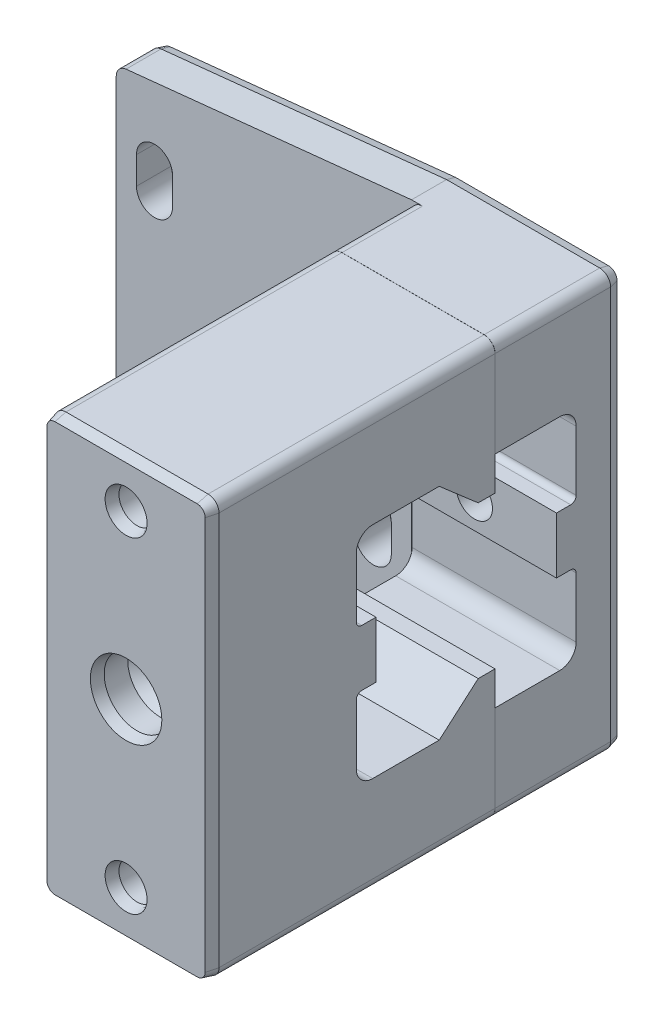
from build123d import *
from OCP.BRepFilletAPI import BRepFilletAPI_MakeChamfer

# Parameters (mm, degrees)
SKETCH1_R       = 1.65
SKETCH1_W       = 27
SKETCH1_H       = 32.4
EXTRUDE1_DEPTH  = 4
EXTRUDE2_DEPTH  = 4
FILLET1_R       = 1
SKETCH_R        = 1.65
EXTRUDE3_DEPTH  = 37.6
EXTRUDE4_REACH  = 52.193
EXTRUDE5_REACH  = 49.347
SKETCH4_R       = 1.65
FILLET2_R       = 1
EXTRUDE6_START  = -15
SKETCH5_W       = 0.01
SKETCH5_H       = 44.520085812
EXTRUDE6_DEPTH  = 15
EXTRUDE7_DEPTH  = 15
SKETCH7_W       = 15
SKETCH7_H       = 5.15
SKETCH7_R       = 1.65
EXTRUDE8_DEPTH  = 1.8
SKETCH_2_R      = 1.65
EXTRUDE9_DEPTH  = 48.347330088
SKETCH8_W       = 15
SKETCH8_H       = 5.15
SKETCH8_R       = 1.65
EXTRUDE10_DEPTH = 1.8
SKETCH11_R      = 3
EXTRUDE15_DEPTH = 3
CHAMFER1_SIZE   = 1.5
FILLET7_R       = 0.5
FILLET8_R       = 0.5
CHAMFER4_SIZE   = 1
CHAMFER4_SIZE2  = 0.267949192
EXTRUDE14_DEPTH = 10.5
CHAMFER5_SIZE   = 0.8
CHAMFER5_SIZE2  = 0.214359354
CHAMFER6_SIZE   = 0.8
CHAMFER6_SIZE2  = 0.214359354
EXTRUDE16_DEPTH = 5
CHAMFER7_SIZE   = 0.8
CHAMFER7_SIZE2  = 0.214359354


with BuildPart() as part:
    # Sketch1 → Extrude1 (new body)
    # profile 1 of 2: a face of its own
    with BuildSketch(Plane.XY):
        Polygon((6.246843528, 16.60570294), (6.246843528, -15.79429706), (6.246843528, -18.59429706), (21.246843528, -18.59429706), (21.246843528, 19.40570294), (6.246843528, 19.40570294), align=None)
        with Locations((13.746843528, -14.49429706)):
            Circle(SKETCH1_R, mode=Mode.SUBTRACT)
        with Locations((13.746843528, 15.30570294)):
            Circle(SKETCH1_R, mode=Mode.SUBTRACT)
    # profile 2 of 2: a face of its own
    with BuildSketch(Plane.XY):
        with Locations((-7.253156472, 0.40570294)):
            Rectangle(SKETCH1_W, SKETCH1_H)
        with BuildLine():
            ThreePointArc((-15.603156472, -9.59429706), (-17.253156472, -11.24429706), (-18.903156472, -9.59429706))
            Line((-18.903156472, -9.59429706), (-18.903156472, -7.09429706))
            ThreePointArc((-18.903156472, -7.09429706), (-17.253156472, -5.44429706), (-15.603156472, -7.09429706))
            Line((-15.603156472, -7.09429706), (-15.603156472, -9.59429706))
        make_face(mode=Mode.SUBTRACT)
        with BuildLine():
            ThreePointArc((4.396843528, -9.59429706), (2.746843528, -11.24429706), (1.096843528, -9.59429706))
            Line((1.096843528, -9.59429706), (1.096843528, -7.09429706))
            ThreePointArc((1.096843528, -7.09429706), (2.746843528, -5.44429706), (4.396843528, -7.09429706))
            Line((4.396843528, -7.09429706), (4.396843528, -9.59429706))
        make_face(mode=Mode.SUBTRACT)
        with BuildLine():
            ThreePointArc((-18.903156472, 10.40570294), (-17.253156472, 12.05570294), (-15.603156472, 10.40570294))
            Line((-15.603156472, 10.40570294), (-15.603156472, 7.90570294))
            ThreePointArc((-15.603156472, 7.90570294), (-17.253156472, 6.25570294), (-18.903156472, 7.90570294))
            Line((-18.903156472, 7.90570294), (-18.903156472, 10.40570294))
        make_face(mode=Mode.SUBTRACT)
        with BuildLine():
            ThreePointArc((1.096843528, 10.40570294), (2.746843528, 12.05570294), (4.396843528, 10.40570294))
            Line((4.396843528, 10.40570294), (4.396843528, 7.90570294))
            ThreePointArc((4.396843528, 7.90570294), (2.746843528, 6.25570294), (1.096843528, 7.90570294))
            Line((1.096843528, 7.90570294), (1.096843528, 10.40570294))
        make_face(mode=Mode.SUBTRACT)
    extrude(amount=EXTRUDE1_DEPTH)

    # Sketch2 → Extrude2 (add)
    with BuildSketch(Plane(origin=(0, 0, 0), x_dir=(-1, 0, 0), z_dir=(0, 0, -1))):
        Polygon((-6.246843528, 19.40570294), (20.753156472, 16.60570294), (-6.246843528, 16.60570294), align=None)
        Polygon((-6.246843528, -15.79429706), (-6.246843528, -18.59429706), (20.753156472, -15.79429706), align=None)
    extrude(amount=-EXTRUDE2_DEPTH)

    # Fillet1
    fillet1_edges = [part.edges().sort_by_distance(p)[0] for p in [
        (-20.753156472, -15.79429706, 2),
        (-20.753156472, 16.60570294, 2),
    ]]
    fillet(fillet1_edges, radius=FILLET1_R)

    # Sketch → Extrude3 (add)
    with BuildSketch(Plane.XY):
        Polygon((21.246843528, 19.40570294), (6.246843528, 19.40570294), (6.246843528, 16.60570294), (6.246843528, -15.79429706), (6.246843528, -18.59429706), (21.246843528, -18.59429706), align=None)
        with Locations((13.746843528, -14.49429706)):
            Circle(SKETCH_R, mode=Mode.SUBTRACT)
        with Locations((13.746843528, 15.30570294)):
            Circle(SKETCH_R, mode=Mode.SUBTRACT)
    extrude(amount=EXTRUDE3_DEPTH)

    # Sketch3 → Extrude4 (cut, up to next)
    with BuildSketch(Plane.ZY.offset(-6.246843528), mode=Mode.PRIVATE) as extrude4_sk1:
        with BuildLine():
            Line((22.55, -9.64429706), (5.45, -9.64429706))
            ThreePointArc((5.45, -9.64429706), (4.389339828, -9.204957232), (3.95, -8.14429706))
            Line((3.95, -8.14429706), (3.95, 8.95570294))
            ThreePointArc((3.95, 8.95570294), (4.389339828, 10.016363112), (5.45, 10.45570294))
            Line((5.45, 10.45570294), (22.55, 10.45570294))
            ThreePointArc((22.55, 10.45570294), (23.610660172, 10.016363112), (24.05, 8.95570294))
            Line((24.05, 8.95570294), (24.05, -8.14429706))
            ThreePointArc((24.05, -8.14429706), (23.610660172, -9.204957232), (22.55, -9.64429706))
        make_face()
    extrude4_tool1 = extrude(extrude4_sk1.sketch, amount=-EXTRUDE4_REACH, mode=Mode.PRIVATE) & part.part
    add(extrude4_tool1.solids().sort_by_distance((6.246844, 0.405703, 14))[0], mode=Mode.SUBTRACT)

    # Sketch4 → Extrude5 (cut, up to next)
    with BuildSketch(Plane(origin=(0, 0, 0), x_dir=(-1, 0, 0), z_dir=(0, 0, -1)), mode=Mode.PRIVATE) as extrude5_sk1:
        with Locations((-13.746843528, 0.40570294)):
            Circle(SKETCH4_R)
    extrude5_tool1 = extrude(extrude5_sk1.sketch, amount=-EXTRUDE5_REACH, mode=Mode.PRIVATE) & part.part
    add(extrude5_tool1.solids().sort_by_distance((13.746844, 0.405703, 0))[0], mode=Mode.SUBTRACT)

    # Fillet2
    fillet2_edges = [part.edges().sort_by_distance(p)[0] for p in [
        (6.246843528, 19.40570294, 20.8),
        (6.246843528, -18.59429706, 20.8),
        (21.246843528, 19.40570294, 18.8),
        (21.246843528, -18.59429706, 18.8),
    ]]
    fillet(fillet2_edges, radius=FILLET2_R)

    # Sketch5 → Extrude6 (cut)
    with BuildSketch(Plane(origin=(21.246843528, 0, 0), x_dir=(0, 0, -1), z_dir=(1, 0, 0)).offset(EXTRUDE6_START)):
        with Locations((-11.365, -0.632215512)):
            Rectangle(SKETCH5_W, SKETCH5_H)
    extrude(amount=EXTRUDE6_DEPTH, mode=Mode.SUBTRACT)


with BuildPart() as extrude6_piece_1:
    # of the separate pieces the step leaves, piece 1, a body of its own (extrude6_pieces)
    add(part.part.solids().sort_by_distance((7.246843528, -18.59429706, 11.37))[0])

    # Sketch6 → Extrude7 (add)
    with BuildSketch(Plane(origin=(21.246843528, 0, 0), x_dir=(0, 0, -1), z_dir=(1, 0, 0))):
        Polygon((-11.37, 10.45570294), (-11.37, 7.362293772), (-12.906590833, 7.362293772), (-16.47, 10.45570294), align=None)
        Polygon((-16.47, -9.64429706), (-11.37, -9.64429706), (-11.37, -6.550887893), (-12.906590833, -6.550887893), align=None)
    extrude(amount=-EXTRUDE7_DEPTH)

    # Sketch 2 → Extrude9 (cut, through all)
    with BuildSketch(Plane(origin=(0, 0, 0), x_dir=(-1, 0, 0), z_dir=(0, 0, -1))):
        with Locations((-13.746843528, 0.40570294)):
            Circle(SKETCH_2_R)
    extrude(amount=-EXTRUDE9_DEPTH, mode=Mode.SUBTRACT)

    # Sketch8 → Extrude10 (add)
    with BuildSketch(Plane(origin=(0, 0, 24.05), x_dir=(-1, 0, 0), z_dir=(0, 0, -1))):
        with Locations((-13.746843528, 0.40570294)):
            Rectangle(SKETCH8_W, SKETCH8_H)
        with Locations((-13.746843528, 0.40570294)):
            Circle(SKETCH8_R, mode=Mode.SUBTRACT)
    extrude(amount=EXTRUDE10_DEPTH)

    # Sketch11 → Extrude15 (cut)
    with BuildSketch(Plane.XY.offset(37.6)):
        with Locations((13.746843528, 0.40570294)):
            Circle(SKETCH11_R)
    extrude(amount=-EXTRUDE15_DEPTH, mode=Mode.SUBTRACT)

    # Chamfer1
    # the kernel refuses this chamfer: 1.5 mm, written as the material it takes off along each edge
    with BuildSketch(Plane(origin=(13.746843528, 0.40570294, 34.6), x_dir=(-1, 0, 0), z_dir=(0, -1, 0))) as chamfer1_piece_1_section:
        Polygon((1.65 + CHAMFER1_SIZE, 0), (1.65, CHAMFER1_SIZE), (1.65, 0), align=None)
    chamfer1_piece_1 = revolve(axis=Axis((13.746843528, 0.40570294, 34.6), (0, 0, -1)), mode=Mode.PRIVATE)
    chamfer1_piece_1 = chamfer1_piece_1 & Plane(origin=(13.746843528, 0.40570294, 33.771694066), x_dir=(1, 0, 0), z_dir=(0, 0, 1)) * Cylinder(3, 13, mode=Mode.PRIVATE)
    add(chamfer1_piece_1, mode=Mode.SUBTRACT)

    # Fillet7
    fillet7_edges = [extrude6_piece_1.edges().sort_by_distance(p)[0] for p in [
        (13.746843528, 2.98070294, 24.05),
        (13.746843528, -2.16929706, 24.05),
    ]]
    fillet(fillet7_edges, radius=FILLET7_R)

    # Chamfer4: one chamfer whose edges measure the first distance from different faces: ONE call of the kernel's chamfer builder (chamfer() names one face for all edges)
    chamfer4_edges_1 = [extrude6_piece_1.edges().sort_by_distance(p)[0] for p in [
        (12.096843528, 15.30570294, 37.6),
    ]]
    chamfer4_side_1 = [extrude6_piece_1.faces().sort_by_distance(p)[0] for p in [
        (12.096843528, 15.30570294, 24.485),
    ]]
    chamfer4_edges_2 = [extrude6_piece_1.edges().sort_by_distance(p)[0] for p in [
        (12.096843528, -14.49429706, 37.6),
    ]]
    chamfer4_side_2 = [extrude6_piece_1.faces().sort_by_distance(p)[0] for p in [
        (12.096843528, -14.49429706, 24.485),
    ]]
    chamfer4_edges_3 = [extrude6_piece_1.edges().sort_by_distance(p)[0] for p in [
        (13.746843528, -18.59429706, 37.6),
    ]]
    chamfer4_side_3 = [extrude6_piece_1.faces().sort_by_distance(p)[0] for p in [
        (13.746843528, -18.59429706, 24.485),
    ]]
    chamfer4_edges_4 = [extrude6_piece_1.edges().sort_by_distance(p)[0] for p in [
        (6.246843528, 0.40570294, 37.6),
    ]]
    chamfer4_side_4 = [extrude6_piece_1.faces().sort_by_distance(p)[0] for p in [
        (6.246843528, 0.40570294, 26.542021551),
    ]]
    chamfer4_edges_5 = [extrude6_piece_1.edges().sort_by_distance(p)[0] for p in [
        (13.746843528, 19.40570294, 37.6),
    ]]
    chamfer4_side_5 = [extrude6_piece_1.faces().sort_by_distance(p)[0] for p in [
        (13.746843528, 19.40570294, 24.485),
    ]]
    chamfer4_edges_6 = [extrude6_piece_1.edges().sort_by_distance(p)[0] for p in [
        (21.246843528, 0.40570294, 37.6),
    ]]
    chamfer4_side_6 = [extrude6_piece_1.faces().sort_by_distance(p)[0] for p in [
        (21.246843528, 0.40570294, 26.542021551),
    ]]
    chamfer4_edges_7 = [extrude6_piece_1.edges().sort_by_distance(p)[0] for p in [
        (20.953950309, 19.112809721, 37.6),
    ]]
    chamfer4_side_7 = [extrude6_piece_1.faces().sort_by_distance(p)[0] for p in [
        (20.953950309, 19.112809721, 24.485),
    ]]
    chamfer4_edges_8 = [extrude6_piece_1.edges().sort_by_distance(p)[0] for p in [
        (20.953950309, -18.301403841, 37.6),
    ]]
    chamfer4_side_8 = [extrude6_piece_1.faces().sort_by_distance(p)[0] for p in [
        (20.953950309, -18.301403841, 24.485),
    ]]
    chamfer4_edges_9 = [extrude6_piece_1.edges().sort_by_distance(p)[0] for p in [
        (6.539736747, 19.112809721, 37.6),
    ]]
    chamfer4_side_9 = [extrude6_piece_1.faces().sort_by_distance(p)[0] for p in [
        (6.539736747, 19.112809721, 24.485),
    ]]
    chamfer4_edges_10 = [extrude6_piece_1.edges().sort_by_distance(p)[0] for p in [
        (6.539736747, -18.301403841, 37.6),
    ]]
    chamfer4_side_10 = [extrude6_piece_1.faces().sort_by_distance(p)[0] for p in [
        (6.539736747, -18.301403841, 24.485),
    ]]
    chamfer4_edges_11 = [extrude6_piece_1.edges().sort_by_distance(p)[0] for p in [
        (10.746843528, 0.40570294, 37.6),
    ]]
    chamfer4_side_11 = [extrude6_piece_1.faces().sort_by_distance(p)[0] for p in [
        (10.746843528, 0.40570294, 36.025),
    ]]
    chamfer4 = BRepFilletAPI_MakeChamfer(extrude6_piece_1.part.solid().wrapped)
    for e in chamfer4_edges_1:
        chamfer4.Add(CHAMFER4_SIZE, CHAMFER4_SIZE2, e.wrapped, chamfer4_side_1[0].wrapped)  # the first distance lies on this face
    for e in chamfer4_edges_2:
        chamfer4.Add(CHAMFER4_SIZE, CHAMFER4_SIZE2, e.wrapped, chamfer4_side_2[0].wrapped)  # the first distance lies on this face
    for e in chamfer4_edges_3:
        chamfer4.Add(CHAMFER4_SIZE, CHAMFER4_SIZE2, e.wrapped, chamfer4_side_3[0].wrapped)  # the first distance lies on this face
    for e in chamfer4_edges_4:
        chamfer4.Add(CHAMFER4_SIZE, CHAMFER4_SIZE2, e.wrapped, chamfer4_side_4[0].wrapped)  # the first distance lies on this face
    for e in chamfer4_edges_5:
        chamfer4.Add(CHAMFER4_SIZE, CHAMFER4_SIZE2, e.wrapped, chamfer4_side_5[0].wrapped)  # the first distance lies on this face
    for e in chamfer4_edges_6:
        chamfer4.Add(CHAMFER4_SIZE, CHAMFER4_SIZE2, e.wrapped, chamfer4_side_6[0].wrapped)  # the first distance lies on this face
    for e in chamfer4_edges_7:
        chamfer4.Add(CHAMFER4_SIZE, CHAMFER4_SIZE2, e.wrapped, chamfer4_side_7[0].wrapped)  # the first distance lies on this face
    for e in chamfer4_edges_8:
        chamfer4.Add(CHAMFER4_SIZE, CHAMFER4_SIZE2, e.wrapped, chamfer4_side_8[0].wrapped)  # the first distance lies on this face
    for e in chamfer4_edges_9:
        chamfer4.Add(CHAMFER4_SIZE, CHAMFER4_SIZE2, e.wrapped, chamfer4_side_9[0].wrapped)  # the first distance lies on this face
    for e in chamfer4_edges_10:
        chamfer4.Add(CHAMFER4_SIZE, CHAMFER4_SIZE2, e.wrapped, chamfer4_side_10[0].wrapped)  # the first distance lies on this face
    for e in chamfer4_edges_11:
        chamfer4.Add(CHAMFER4_SIZE, CHAMFER4_SIZE2, e.wrapped, chamfer4_side_11[0].wrapped)  # the first distance lies on this face
    add(Compound.cast(chamfer4.Shape()), mode=Mode.REPLACE)

    # Sketch10 → Extrude14 (cut)
    with BuildSketch(Plane(origin=(0, 0, 11.37), x_dir=(-1, 0, 0), z_dir=(0, 0, -1))):
        Polygon((-10.917827209, 15.30570294), (-12.332335368, 17.75570294), (-15.161351687, 17.75570294), (-16.575859847, 15.30570294), (-15.161351687, 12.85570294), (-12.332335368, 12.85570294), align=None)
        Polygon((-10.917827209, -14.49429706), (-12.332335368, -12.04429706), (-15.161351687, -12.04429706), (-16.575859847, -14.49429706), (-15.161351687, -16.94429706), (-12.332335368, -16.94429706), align=None)
    extrude(amount=-EXTRUDE14_DEPTH, mode=Mode.SUBTRACT)

    # Chamfer5: one chamfer whose edges measure the first distance from different faces: ONE call of the kernel's chamfer builder (chamfer() names one face for all edges)
    chamfer5_edges_1 = [extrude6_piece_1.edges().sort_by_distance(p)[0] for p in [
        (11.625081289, 14.08070294, 11.37),
    ]]
    chamfer5_side_1 = [extrude6_piece_1.faces().sort_by_distance(p)[0] for p in [
        (11.625081289, 14.08070294, 16.62),
    ]]
    chamfer5_edges_2 = [extrude6_piece_1.edges().sort_by_distance(p)[0] for p in [
        (11.625081289, 16.53070294, 11.37),
    ]]
    chamfer5_side_2 = [extrude6_piece_1.faces().sort_by_distance(p)[0] for p in [
        (11.625081289, 16.53070294, 16.62),
    ]]
    chamfer5_edges_3 = [extrude6_piece_1.edges().sort_by_distance(p)[0] for p in [
        (13.746843528, 17.75570294, 11.37),
    ]]
    chamfer5_side_3 = [extrude6_piece_1.faces().sort_by_distance(p)[0] for p in [
        (13.746843528, 17.75570294, 16.62),
    ]]
    chamfer5_edges_4 = [extrude6_piece_1.edges().sort_by_distance(p)[0] for p in [
        (15.868605767, 16.53070294, 11.37),
    ]]
    chamfer5_side_4 = [extrude6_piece_1.faces().sort_by_distance(p)[0] for p in [
        (15.868605767, 16.53070294, 16.62),
    ]]
    chamfer5_edges_5 = [extrude6_piece_1.edges().sort_by_distance(p)[0] for p in [
        (15.868605767, 14.08070294, 11.37),
    ]]
    chamfer5_side_5 = [extrude6_piece_1.faces().sort_by_distance(p)[0] for p in [
        (15.868605767, 14.08070294, 16.62),
    ]]
    chamfer5_edges_6 = [extrude6_piece_1.edges().sort_by_distance(p)[0] for p in [
        (13.746843528, 12.85570294, 11.37),
    ]]
    chamfer5_side_6 = [extrude6_piece_1.faces().sort_by_distance(p)[0] for p in [
        (13.746843528, 12.85570294, 16.62),
    ]]
    chamfer5_edges_7 = [extrude6_piece_1.edges().sort_by_distance(p)[0] for p in [
        (11.625081289, -15.71929706, 11.37),
    ]]
    chamfer5_side_7 = [extrude6_piece_1.faces().sort_by_distance(p)[0] for p in [
        (11.625081289, -15.71929706, 16.62),
    ]]
    chamfer5_edges_8 = [extrude6_piece_1.edges().sort_by_distance(p)[0] for p in [
        (11.625081289, -13.26929706, 11.37),
    ]]
    chamfer5_side_8 = [extrude6_piece_1.faces().sort_by_distance(p)[0] for p in [
        (11.625081289, -13.26929706, 16.62),
    ]]
    chamfer5_edges_9 = [extrude6_piece_1.edges().sort_by_distance(p)[0] for p in [
        (13.746843528, -12.04429706, 11.37),
    ]]
    chamfer5_side_9 = [extrude6_piece_1.faces().sort_by_distance(p)[0] for p in [
        (13.746843528, -12.04429706, 16.62),
    ]]
    chamfer5_edges_10 = [extrude6_piece_1.edges().sort_by_distance(p)[0] for p in [
        (15.868605767, -13.26929706, 11.37),
    ]]
    chamfer5_side_10 = [extrude6_piece_1.faces().sort_by_distance(p)[0] for p in [
        (15.868605767, -13.26929706, 16.62),
    ]]
    chamfer5_edges_11 = [extrude6_piece_1.edges().sort_by_distance(p)[0] for p in [
        (15.868605767, -15.71929706, 11.37),
    ]]
    chamfer5_side_11 = [extrude6_piece_1.faces().sort_by_distance(p)[0] for p in [
        (15.868605767, -15.71929706, 16.62),
    ]]
    chamfer5_edges_12 = [extrude6_piece_1.edges().sort_by_distance(p)[0] for p in [
        (13.746843528, -16.94429706, 11.37),
    ]]
    chamfer5_side_12 = [extrude6_piece_1.faces().sort_by_distance(p)[0] for p in [
        (13.746843528, -16.94429706, 16.62),
    ]]
    chamfer5 = BRepFilletAPI_MakeChamfer(extrude6_piece_1.part.solid().wrapped)
    for e in chamfer5_edges_1:
        chamfer5.Add(CHAMFER5_SIZE, CHAMFER5_SIZE2, e.wrapped, chamfer5_side_1[0].wrapped)  # the first distance lies on this face
    for e in chamfer5_edges_2:
        chamfer5.Add(CHAMFER5_SIZE, CHAMFER5_SIZE2, e.wrapped, chamfer5_side_2[0].wrapped)  # the first distance lies on this face
    for e in chamfer5_edges_3:
        chamfer5.Add(CHAMFER5_SIZE, CHAMFER5_SIZE2, e.wrapped, chamfer5_side_3[0].wrapped)  # the first distance lies on this face
    for e in chamfer5_edges_4:
        chamfer5.Add(CHAMFER5_SIZE, CHAMFER5_SIZE2, e.wrapped, chamfer5_side_4[0].wrapped)  # the first distance lies on this face
    for e in chamfer5_edges_5:
        chamfer5.Add(CHAMFER5_SIZE, CHAMFER5_SIZE2, e.wrapped, chamfer5_side_5[0].wrapped)  # the first distance lies on this face
    for e in chamfer5_edges_6:
        chamfer5.Add(CHAMFER5_SIZE, CHAMFER5_SIZE2, e.wrapped, chamfer5_side_6[0].wrapped)  # the first distance lies on this face
    for e in chamfer5_edges_7:
        chamfer5.Add(CHAMFER5_SIZE, CHAMFER5_SIZE2, e.wrapped, chamfer5_side_7[0].wrapped)  # the first distance lies on this face
    for e in chamfer5_edges_8:
        chamfer5.Add(CHAMFER5_SIZE, CHAMFER5_SIZE2, e.wrapped, chamfer5_side_8[0].wrapped)  # the first distance lies on this face
    for e in chamfer5_edges_9:
        chamfer5.Add(CHAMFER5_SIZE, CHAMFER5_SIZE2, e.wrapped, chamfer5_side_9[0].wrapped)  # the first distance lies on this face
    for e in chamfer5_edges_10:
        chamfer5.Add(CHAMFER5_SIZE, CHAMFER5_SIZE2, e.wrapped, chamfer5_side_10[0].wrapped)  # the first distance lies on this face
    for e in chamfer5_edges_11:
        chamfer5.Add(CHAMFER5_SIZE, CHAMFER5_SIZE2, e.wrapped, chamfer5_side_11[0].wrapped)  # the first distance lies on this face
    for e in chamfer5_edges_12:
        chamfer5.Add(CHAMFER5_SIZE, CHAMFER5_SIZE2, e.wrapped, chamfer5_side_12[0].wrapped)  # the first distance lies on this face
    add(Compound.cast(chamfer5.Shape()), mode=Mode.REPLACE)


with BuildPart() as extrude6_piece_2:
    # of the separate pieces the step leaves, piece 2, a body of its own (extrude6_pieces)
    add(part.part.solids().sort_by_distance((20.246843528, -18.59429706, 0))[0])

    # Sketch7 → Extrude8 (add)
    with BuildSketch(Plane.XY.offset(3.95)):
        with Locations((13.746843528, 0.40570294)):
            Rectangle(SKETCH7_W, SKETCH7_H)
        with Locations(Location((13.746843528, 0.40570294, 0), (0, 0, 180))):
            Circle(SKETCH7_R, mode=Mode.SUBTRACT)
    extrude(amount=EXTRUDE8_DEPTH)

    # Fillet8
    # the kernel refuses this fillet: 0.5 mm, written as the material it adds along each edge
    with BuildSketch(Plane(origin=(6.246843528, -2.16929706, 3.95), x_dir=(0, -1, 0), z_dir=(1, 0, 0)), Plane(origin=(21.246843528, 2.98070294, 3.95), x_dir=(0, 1, 0), z_dir=(-1, 0, 0))) as fillet8_piece_1:
        with BuildLine():
            CenterArc((FILLET8_R, -FILLET8_R), FILLET8_R, 90, 90)
            Line((0, -FILLET8_R), (0, 0))
            Line((0, 0), (FILLET8_R, 0))
        make_face()
    extrude(amount=15)

    # Chamfer6: one chamfer whose edges measure the first distance from different faces: ONE call of the kernel's chamfer builder (chamfer() names one face for all edges)
    chamfer6_edges_1 = [extrude6_piece_2.edges().sort_by_distance(p)[0] for p in [
        (13.246843528, 19.40570294, 0),
    ]]
    chamfer6_side_1 = [extrude6_piece_2.faces().sort_by_distance(p)[0] for p in [
        (13.562244372, 19.40570294, 5.582953586),
    ]]
    chamfer6_edges_2 = [extrude6_piece_2.edges().sort_by_distance(p)[0] for p in [
        (15.396843528, 0.40570294, 0),
    ]]
    chamfer6_side_2 = [extrude6_piece_2.faces().sort_by_distance(p)[0] for p in [
        (15.396843528, 0.40570294, 2.875),
    ]]
    chamfer6_edges_3 = [extrude6_piece_2.edges().sort_by_distance(p)[0] for p in [
        (13.246843528, -18.59429706, 0),
    ]]
    chamfer6_side_3 = [extrude6_piece_2.faces().sort_by_distance(p)[0] for p in [
        (13.562244372, -18.59429706, 5.582953586),
    ]]
    chamfer6_edges_4 = [extrude6_piece_2.edges().sort_by_distance(p)[0] for p in [
        (-18.903156472, -8.34429706, 0),
    ]]
    chamfer6_side_4 = [extrude6_piece_2.faces().sort_by_distance(p)[0] for p in [
        (-18.903156472, -8.34429706, 2),
    ]]
    chamfer6_edges_5 = [extrude6_piece_2.edges().sort_by_distance(p)[0] for p in [
        (1.096843528, -8.34429706, 0),
    ]]
    chamfer6_side_5 = [extrude6_piece_2.faces().sort_by_distance(p)[0] for p in [
        (1.096843528, -8.34429706, 2),
    ]]
    chamfer6_edges_6 = [extrude6_piece_2.edges().sort_by_distance(p)[0] for p in [
        (4.396843528, 9.15570294, 0),
    ]]
    chamfer6_side_6 = [extrude6_piece_2.faces().sort_by_distance(p)[0] for p in [
        (4.396843528, 9.15570294, 2),
    ]]
    chamfer6_edges_7 = [extrude6_piece_2.edges().sort_by_distance(p)[0] for p in [
        (21.246843528, 0.40570294, 0),
    ]]
    chamfer6_side_7 = [extrude6_piece_2.faces().sort_by_distance(p)[0] for p in [
        (21.246843528, 0.40570294, 4.557899541),
    ]]
    chamfer6_edges_8 = [extrude6_piece_2.edges().sort_by_distance(p)[0] for p in [
        (-15.603156472, 9.15570294, 0),
    ]]
    chamfer6_side_8 = [extrude6_piece_2.faces().sort_by_distance(p)[0] for p in [
        (-15.603156472, 9.15570294, 2),
    ]]
    chamfer6_edges_9 = [extrude6_piece_2.edges().sort_by_distance(p)[0] for p in [
        (12.096843528, -14.49429706, 0),
    ]]
    chamfer6_side_9 = [extrude6_piece_2.faces().sort_by_distance(p)[0] for p in [
        (12.096843528, -14.49429706, 5.68),
    ]]
    chamfer6_edges_10 = [extrude6_piece_2.edges().sort_by_distance(p)[0] for p in [
        (12.096843528, 15.30570294, 0),
    ]]
    chamfer6_side_10 = [extrude6_piece_2.faces().sort_by_distance(p)[0] for p in [
        (12.096843528, 15.30570294, 5.68),
    ]]
    chamfer6_edges_11 = [extrude6_piece_2.edges().sort_by_distance(p)[0] for p in [
        (20.953950309, -18.301403841, 0),
    ]]
    chamfer6_side_11 = [extrude6_piece_2.faces().sort_by_distance(p)[0] for p in [
        (20.953950309, -18.301403841, 5.68),
    ]]
    chamfer6_edges_12 = [extrude6_piece_2.edges().sort_by_distance(p)[0] for p in [
        (-6.804731734, -17.240800366, 0),
    ]]
    chamfer6_side_12 = [extrude6_piece_2.faces().sort_by_distance(p)[0] for p in [
        (-6.804731734, -17.240800366, 2),
    ]]
    chamfer6_edges_13 = [extrude6_piece_2.edges().sort_by_distance(p)[0] for p in [
        (-20.495837603, -15.562283148, 0),
    ]]
    chamfer6_side_13 = [extrude6_piece_2.faces().sort_by_distance(p)[0] for p in [
        (-20.495837603, -15.562283148, 2),
    ]]
    chamfer6_edges_14 = [extrude6_piece_2.edges().sort_by_distance(p)[0] for p in [
        (-20.753156472, 0.40570294, 0),
    ]]
    chamfer6_side_14 = [extrude6_piece_2.faces().sort_by_distance(p)[0] for p in [
        (-20.753156472, 0.40570294, 2),
    ]]
    chamfer6_edges_15 = [extrude6_piece_2.edges().sort_by_distance(p)[0] for p in [
        (-20.495837603, 16.373689028, 0),
    ]]
    chamfer6_side_15 = [extrude6_piece_2.faces().sort_by_distance(p)[0] for p in [
        (-20.495837603, 16.373689028, 2),
    ]]
    chamfer6_edges_16 = [extrude6_piece_2.edges().sort_by_distance(p)[0] for p in [
        (-6.804731734, 18.052206246, 0),
    ]]
    chamfer6_side_16 = [extrude6_piece_2.faces().sort_by_distance(p)[0] for p in [
        (-6.804731734, 18.052206246, 2),
    ]]
    chamfer6_edges_17 = [extrude6_piece_2.edges().sort_by_distance(p)[0] for p in [
        (20.953950309, 19.112809721, 0),
    ]]
    chamfer6_side_17 = [extrude6_piece_2.faces().sort_by_distance(p)[0] for p in [
        (20.953950309, 19.112809721, 5.68),
    ]]
    chamfer6_edges_18 = [extrude6_piece_2.edges().sort_by_distance(p)[0] for p in [
        (-17.253156472, 6.25570294, 0),
    ]]
    chamfer6_side_18 = [extrude6_piece_2.faces().sort_by_distance(p)[0] for p in [
        (-17.253156472, 6.25570294, 2),
    ]]
    chamfer6_edges_19 = [extrude6_piece_2.edges().sort_by_distance(p)[0] for p in [
        (-17.253156472, 12.05570294, 0),
    ]]
    chamfer6_side_19 = [extrude6_piece_2.faces().sort_by_distance(p)[0] for p in [
        (-17.253156472, 12.05570294, 2),
    ]]
    chamfer6_edges_20 = [extrude6_piece_2.edges().sort_by_distance(p)[0] for p in [
        (-18.903156472, 9.15570294, 0),
    ]]
    chamfer6_side_20 = [extrude6_piece_2.faces().sort_by_distance(p)[0] for p in [
        (-18.903156472, 9.15570294, 2),
    ]]
    chamfer6_edges_21 = [extrude6_piece_2.edges().sort_by_distance(p)[0] for p in [
        (-17.253156472, -5.44429706, 0),
    ]]
    chamfer6_side_21 = [extrude6_piece_2.faces().sort_by_distance(p)[0] for p in [
        (-17.253156472, -5.44429706, 2),
    ]]
    chamfer6_edges_22 = [extrude6_piece_2.edges().sort_by_distance(p)[0] for p in [
        (-17.253156472, -11.24429706, 0),
    ]]
    chamfer6_side_22 = [extrude6_piece_2.faces().sort_by_distance(p)[0] for p in [
        (-17.253156472, -11.24429706, 2),
    ]]
    chamfer6_edges_23 = [extrude6_piece_2.edges().sort_by_distance(p)[0] for p in [
        (-15.603156472, -8.34429706, 0),
    ]]
    chamfer6_side_23 = [extrude6_piece_2.faces().sort_by_distance(p)[0] for p in [
        (-15.603156472, -8.34429706, 2),
    ]]
    chamfer6_edges_24 = [extrude6_piece_2.edges().sort_by_distance(p)[0] for p in [
        (2.746843528, -5.44429706, 0),
    ]]
    chamfer6_side_24 = [extrude6_piece_2.faces().sort_by_distance(p)[0] for p in [
        (2.746843528, -5.44429706, 2),
    ]]
    chamfer6_edges_25 = [extrude6_piece_2.edges().sort_by_distance(p)[0] for p in [
        (2.746843528, -11.24429706, 0),
    ]]
    chamfer6_side_25 = [extrude6_piece_2.faces().sort_by_distance(p)[0] for p in [
        (2.746843528, -11.24429706, 2),
    ]]
    chamfer6_edges_26 = [extrude6_piece_2.edges().sort_by_distance(p)[0] for p in [
        (4.396843528, -8.34429706, 0),
    ]]
    chamfer6_side_26 = [extrude6_piece_2.faces().sort_by_distance(p)[0] for p in [
        (4.396843528, -8.34429706, 2),
    ]]
    chamfer6_edges_27 = [extrude6_piece_2.edges().sort_by_distance(p)[0] for p in [
        (2.746843528, 6.25570294, 0),
    ]]
    chamfer6_side_27 = [extrude6_piece_2.faces().sort_by_distance(p)[0] for p in [
        (2.746843528, 6.25570294, 2),
    ]]
    chamfer6_edges_28 = [extrude6_piece_2.edges().sort_by_distance(p)[0] for p in [
        (2.746843528, 12.05570294, 0),
    ]]
    chamfer6_side_28 = [extrude6_piece_2.faces().sort_by_distance(p)[0] for p in [
        (2.746843528, 12.05570294, 2),
    ]]
    chamfer6_edges_29 = [extrude6_piece_2.edges().sort_by_distance(p)[0] for p in [
        (1.096843528, 9.15570294, 0),
    ]]
    chamfer6_side_29 = [extrude6_piece_2.faces().sort_by_distance(p)[0] for p in [
        (1.096843528, 9.15570294, 2),
    ]]
    chamfer6 = BRepFilletAPI_MakeChamfer(extrude6_piece_2.part.solid().wrapped)
    for e in chamfer6_edges_1:
        chamfer6.Add(CHAMFER6_SIZE, CHAMFER6_SIZE2, e.wrapped, chamfer6_side_1[0].wrapped)  # the first distance lies on this face
    for e in chamfer6_edges_2:
        chamfer6.Add(CHAMFER6_SIZE, CHAMFER6_SIZE2, e.wrapped, chamfer6_side_2[0].wrapped)  # the first distance lies on this face
    for e in chamfer6_edges_3:
        chamfer6.Add(CHAMFER6_SIZE, CHAMFER6_SIZE2, e.wrapped, chamfer6_side_3[0].wrapped)  # the first distance lies on this face
    for e in chamfer6_edges_4:
        chamfer6.Add(CHAMFER6_SIZE, CHAMFER6_SIZE2, e.wrapped, chamfer6_side_4[0].wrapped)  # the first distance lies on this face
    for e in chamfer6_edges_5:
        chamfer6.Add(CHAMFER6_SIZE, CHAMFER6_SIZE2, e.wrapped, chamfer6_side_5[0].wrapped)  # the first distance lies on this face
    for e in chamfer6_edges_6:
        chamfer6.Add(CHAMFER6_SIZE, CHAMFER6_SIZE2, e.wrapped, chamfer6_side_6[0].wrapped)  # the first distance lies on this face
    for e in chamfer6_edges_7:
        chamfer6.Add(CHAMFER6_SIZE, CHAMFER6_SIZE2, e.wrapped, chamfer6_side_7[0].wrapped)  # the first distance lies on this face
    for e in chamfer6_edges_8:
        chamfer6.Add(CHAMFER6_SIZE, CHAMFER6_SIZE2, e.wrapped, chamfer6_side_8[0].wrapped)  # the first distance lies on this face
    for e in chamfer6_edges_9:
        chamfer6.Add(CHAMFER6_SIZE, CHAMFER6_SIZE2, e.wrapped, chamfer6_side_9[0].wrapped)  # the first distance lies on this face
    for e in chamfer6_edges_10:
        chamfer6.Add(CHAMFER6_SIZE, CHAMFER6_SIZE2, e.wrapped, chamfer6_side_10[0].wrapped)  # the first distance lies on this face
    for e in chamfer6_edges_11:
        chamfer6.Add(CHAMFER6_SIZE, CHAMFER6_SIZE2, e.wrapped, chamfer6_side_11[0].wrapped)  # the first distance lies on this face
    for e in chamfer6_edges_12:
        chamfer6.Add(CHAMFER6_SIZE, CHAMFER6_SIZE2, e.wrapped, chamfer6_side_12[0].wrapped)  # the first distance lies on this face
    for e in chamfer6_edges_13:
        chamfer6.Add(CHAMFER6_SIZE, CHAMFER6_SIZE2, e.wrapped, chamfer6_side_13[0].wrapped)  # the first distance lies on this face
    for e in chamfer6_edges_14:
        chamfer6.Add(CHAMFER6_SIZE, CHAMFER6_SIZE2, e.wrapped, chamfer6_side_14[0].wrapped)  # the first distance lies on this face
    for e in chamfer6_edges_15:
        chamfer6.Add(CHAMFER6_SIZE, CHAMFER6_SIZE2, e.wrapped, chamfer6_side_15[0].wrapped)  # the first distance lies on this face
    for e in chamfer6_edges_16:
        chamfer6.Add(CHAMFER6_SIZE, CHAMFER6_SIZE2, e.wrapped, chamfer6_side_16[0].wrapped)  # the first distance lies on this face
    for e in chamfer6_edges_17:
        chamfer6.Add(CHAMFER6_SIZE, CHAMFER6_SIZE2, e.wrapped, chamfer6_side_17[0].wrapped)  # the first distance lies on this face
    for e in chamfer6_edges_18:
        chamfer6.Add(CHAMFER6_SIZE, CHAMFER6_SIZE2, e.wrapped, chamfer6_side_18[0].wrapped)  # the first distance lies on this face
    for e in chamfer6_edges_19:
        chamfer6.Add(CHAMFER6_SIZE, CHAMFER6_SIZE2, e.wrapped, chamfer6_side_19[0].wrapped)  # the first distance lies on this face
    for e in chamfer6_edges_20:
        chamfer6.Add(CHAMFER6_SIZE, CHAMFER6_SIZE2, e.wrapped, chamfer6_side_20[0].wrapped)  # the first distance lies on this face
    for e in chamfer6_edges_21:
        chamfer6.Add(CHAMFER6_SIZE, CHAMFER6_SIZE2, e.wrapped, chamfer6_side_21[0].wrapped)  # the first distance lies on this face
    for e in chamfer6_edges_22:
        chamfer6.Add(CHAMFER6_SIZE, CHAMFER6_SIZE2, e.wrapped, chamfer6_side_22[0].wrapped)  # the first distance lies on this face
    for e in chamfer6_edges_23:
        chamfer6.Add(CHAMFER6_SIZE, CHAMFER6_SIZE2, e.wrapped, chamfer6_side_23[0].wrapped)  # the first distance lies on this face
    for e in chamfer6_edges_24:
        chamfer6.Add(CHAMFER6_SIZE, CHAMFER6_SIZE2, e.wrapped, chamfer6_side_24[0].wrapped)  # the first distance lies on this face
    for e in chamfer6_edges_25:
        chamfer6.Add(CHAMFER6_SIZE, CHAMFER6_SIZE2, e.wrapped, chamfer6_side_25[0].wrapped)  # the first distance lies on this face
    for e in chamfer6_edges_26:
        chamfer6.Add(CHAMFER6_SIZE, CHAMFER6_SIZE2, e.wrapped, chamfer6_side_26[0].wrapped)  # the first distance lies on this face
    for e in chamfer6_edges_27:
        chamfer6.Add(CHAMFER6_SIZE, CHAMFER6_SIZE2, e.wrapped, chamfer6_side_27[0].wrapped)  # the first distance lies on this face
    for e in chamfer6_edges_28:
        chamfer6.Add(CHAMFER6_SIZE, CHAMFER6_SIZE2, e.wrapped, chamfer6_side_28[0].wrapped)  # the first distance lies on this face
    for e in chamfer6_edges_29:
        chamfer6.Add(CHAMFER6_SIZE, CHAMFER6_SIZE2, e.wrapped, chamfer6_side_29[0].wrapped)  # the first distance lies on this face
    add(Compound.cast(chamfer6.Shape()), mode=Mode.REPLACE)

    # Sketch12 → Extrude16 (cut)
    with BuildSketch(Plane.XY.offset(11.36)):
        Polygon((16.575859847, 15.30570294), (15.161351687, 17.75570294), (12.332335368, 17.75570294), (10.917827209, 15.30570294), (12.332335368, 12.85570294), (15.161351687, 12.85570294), align=None)
        Polygon((16.575859847, -14.49429706), (15.161351687, -12.04429706), (12.332335368, -12.04429706), (10.917827209, -14.49429706), (12.332335368, -16.94429706), (15.161351687, -16.94429706), align=None)
    extrude(amount=-EXTRUDE16_DEPTH, mode=Mode.SUBTRACT)

    # Chamfer7: one chamfer whose edges measure the first distance from different faces: ONE call of the kernel's chamfer builder (chamfer() names one face for all edges)
    chamfer7_edges_1 = [extrude6_piece_2.edges().sort_by_distance(p)[0] for p in [
        (15.868605767, 14.08070294, 11.36),
    ]]
    chamfer7_side_1 = [extrude6_piece_2.faces().sort_by_distance(p)[0] for p in [
        (15.868605767, 14.08070294, 8.86),
    ]]
    chamfer7_edges_2 = [extrude6_piece_2.edges().sort_by_distance(p)[0] for p in [
        (15.868605767, 16.53070294, 11.36),
    ]]
    chamfer7_side_2 = [extrude6_piece_2.faces().sort_by_distance(p)[0] for p in [
        (15.868605767, 16.53070294, 8.86),
    ]]
    chamfer7_edges_3 = [extrude6_piece_2.edges().sort_by_distance(p)[0] for p in [
        (13.746843528, 17.75570294, 11.36),
    ]]
    chamfer7_side_3 = [extrude6_piece_2.faces().sort_by_distance(p)[0] for p in [
        (13.746843528, 17.75570294, 8.86),
    ]]
    chamfer7_edges_4 = [extrude6_piece_2.edges().sort_by_distance(p)[0] for p in [
        (11.625081289, 16.53070294, 11.36),
    ]]
    chamfer7_side_4 = [extrude6_piece_2.faces().sort_by_distance(p)[0] for p in [
        (11.625081289, 16.53070294, 8.86),
    ]]
    chamfer7_edges_5 = [extrude6_piece_2.edges().sort_by_distance(p)[0] for p in [
        (11.625081289, 14.08070294, 11.36),
    ]]
    chamfer7_side_5 = [extrude6_piece_2.faces().sort_by_distance(p)[0] for p in [
        (11.625081289, 14.08070294, 8.86),
    ]]
    chamfer7_edges_6 = [extrude6_piece_2.edges().sort_by_distance(p)[0] for p in [
        (13.746843528, 12.85570294, 11.36),
    ]]
    chamfer7_side_6 = [extrude6_piece_2.faces().sort_by_distance(p)[0] for p in [
        (13.746843528, 12.85570294, 8.86),
    ]]
    chamfer7_edges_7 = [extrude6_piece_2.edges().sort_by_distance(p)[0] for p in [
        (15.868605767, -15.71929706, 11.36),
    ]]
    chamfer7_side_7 = [extrude6_piece_2.faces().sort_by_distance(p)[0] for p in [
        (15.868605767, -15.71929706, 8.86),
    ]]
    chamfer7_edges_8 = [extrude6_piece_2.edges().sort_by_distance(p)[0] for p in [
        (15.868605767, -13.26929706, 11.36),
    ]]
    chamfer7_side_8 = [extrude6_piece_2.faces().sort_by_distance(p)[0] for p in [
        (15.868605767, -13.26929706, 8.86),
    ]]
    chamfer7_edges_9 = [extrude6_piece_2.edges().sort_by_distance(p)[0] for p in [
        (13.746843528, -12.04429706, 11.36),
    ]]
    chamfer7_side_9 = [extrude6_piece_2.faces().sort_by_distance(p)[0] for p in [
        (13.746843528, -12.04429706, 8.86),
    ]]
    chamfer7_edges_10 = [extrude6_piece_2.edges().sort_by_distance(p)[0] for p in [
        (11.625081289, -13.26929706, 11.36),
    ]]
    chamfer7_side_10 = [extrude6_piece_2.faces().sort_by_distance(p)[0] for p in [
        (11.625081289, -13.26929706, 8.86),
    ]]
    chamfer7_edges_11 = [extrude6_piece_2.edges().sort_by_distance(p)[0] for p in [
        (11.625081289, -15.71929706, 11.36),
    ]]
    chamfer7_side_11 = [extrude6_piece_2.faces().sort_by_distance(p)[0] for p in [
        (11.625081289, -15.71929706, 8.86),
    ]]
    chamfer7_edges_12 = [extrude6_piece_2.edges().sort_by_distance(p)[0] for p in [
        (13.746843528, -16.94429706, 11.36),
    ]]
    chamfer7_side_12 = [extrude6_piece_2.faces().sort_by_distance(p)[0] for p in [
        (13.746843528, -16.94429706, 8.86),
    ]]
    chamfer7 = BRepFilletAPI_MakeChamfer(extrude6_piece_2.part.solid().wrapped)
    for e in chamfer7_edges_1:
        chamfer7.Add(CHAMFER7_SIZE, CHAMFER7_SIZE2, e.wrapped, chamfer7_side_1[0].wrapped)  # the first distance lies on this face
    for e in chamfer7_edges_2:
        chamfer7.Add(CHAMFER7_SIZE, CHAMFER7_SIZE2, e.wrapped, chamfer7_side_2[0].wrapped)  # the first distance lies on this face
    for e in chamfer7_edges_3:
        chamfer7.Add(CHAMFER7_SIZE, CHAMFER7_SIZE2, e.wrapped, chamfer7_side_3[0].wrapped)  # the first distance lies on this face
    for e in chamfer7_edges_4:
        chamfer7.Add(CHAMFER7_SIZE, CHAMFER7_SIZE2, e.wrapped, chamfer7_side_4[0].wrapped)  # the first distance lies on this face
    for e in chamfer7_edges_5:
        chamfer7.Add(CHAMFER7_SIZE, CHAMFER7_SIZE2, e.wrapped, chamfer7_side_5[0].wrapped)  # the first distance lies on this face
    for e in chamfer7_edges_6:
        chamfer7.Add(CHAMFER7_SIZE, CHAMFER7_SIZE2, e.wrapped, chamfer7_side_6[0].wrapped)  # the first distance lies on this face
    for e in chamfer7_edges_7:
        chamfer7.Add(CHAMFER7_SIZE, CHAMFER7_SIZE2, e.wrapped, chamfer7_side_7[0].wrapped)  # the first distance lies on this face
    for e in chamfer7_edges_8:
        chamfer7.Add(CHAMFER7_SIZE, CHAMFER7_SIZE2, e.wrapped, chamfer7_side_8[0].wrapped)  # the first distance lies on this face
    for e in chamfer7_edges_9:
        chamfer7.Add(CHAMFER7_SIZE, CHAMFER7_SIZE2, e.wrapped, chamfer7_side_9[0].wrapped)  # the first distance lies on this face
    for e in chamfer7_edges_10:
        chamfer7.Add(CHAMFER7_SIZE, CHAMFER7_SIZE2, e.wrapped, chamfer7_side_10[0].wrapped)  # the first distance lies on this face
    for e in chamfer7_edges_11:
        chamfer7.Add(CHAMFER7_SIZE, CHAMFER7_SIZE2, e.wrapped, chamfer7_side_11[0].wrapped)  # the first distance lies on this face
    for e in chamfer7_edges_12:
        chamfer7.Add(CHAMFER7_SIZE, CHAMFER7_SIZE2, e.wrapped, chamfer7_side_12[0].wrapped)  # the first distance lies on this face
    add(Compound.cast(chamfer7.Shape()), mode=Mode.REPLACE)


solid = Compound([extrude6_piece_1.part, extrude6_piece_2.part])
